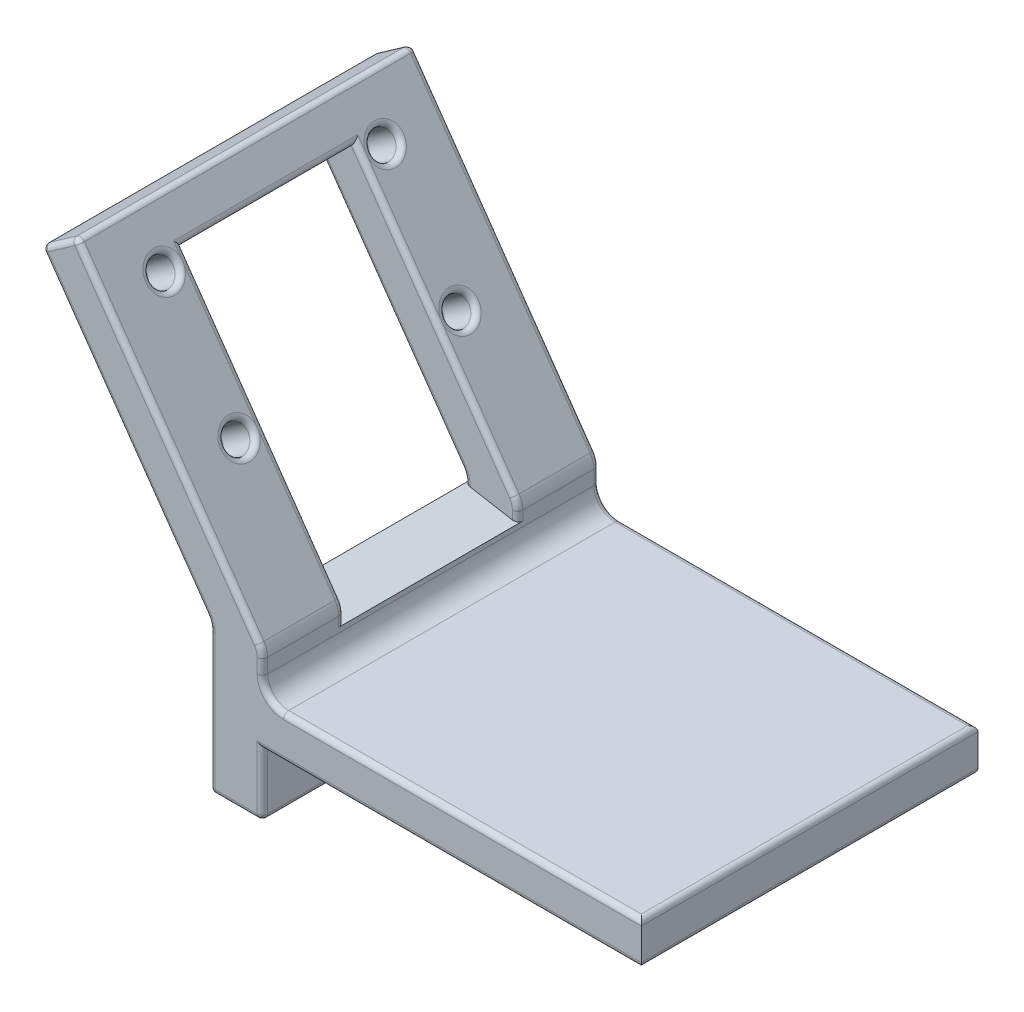
from build123d import *

# Parameters (mm, degrees)
BOSS_EXTRU_1_DEPTH      = 32
ESQUISSE2_R             = 1.25
ENL_V_MAT_EXTRU_1_DEPTH = 62.748876622
ESQUISSE3_R             = 1.25
ESQUISSE3_W             = 16.5
ESQUISSE3_H             = 24
ENL_V_MAT_EXTRU_2_DEPTH = 59.140175519
ESQUISSE4_R             = 2.15
ENL_V_MAT_EXTRU_3_DEPTH = 2
CHANFREIN1_SIZE         = 5
CONG_1_R                = 2
CONG_2_R                = 0.5


# Some blends are built 0.0001 mm under size
with BuildPart() as part:
    # Esquisse1 → Boss.-Extru.1 (new body)
    with BuildSketch(Plane.XY):
        Polygon((0, 0), (0, -6), (-5, -6), (-5, 8), (-21.060140218, 30.93625724), (-17.70508986, 33.285488792), (0, 8), (0, 4), (36, 4), (36, 0), align=None)
    extrude(amount=BOSS_EXTRU_1_DEPTH)

    # Esquisse2 → Enlèv. mat.-Extru.1 (cut, through all)
    with BuildSketch(Plane.ZY.offset(5)):
        with Locations(Location((8, -2.7, 0), (0, 0, 270))):
            Circle(ESQUISSE2_R)
        with Locations(Location((24, -2.7, 0), (0, 0, 270))):
            Circle(ESQUISSE2_R)
    extrude(amount=-ENL_V_MAT_EXTRU_1_DEPTH, mode=Mode.SUBTRACT)

    # Esquisse3 → Enlèv. mat.-Extru.2 (cut, through all)
    with BuildSketch(Plane(origin=(0.403720125, 0.282687875, 0), x_dir=(0, 0, 1), z_dir=(-0.819152044288991, -0.5735764363510472, 0))):
        with Locations(Location((5.5, 32.421098536, 0), (0, 0, 270))):
            Circle(ESQUISSE3_R)
        with Locations(Location((5.5, 20.021098536, 0), (0, 0, 270))):
            Circle(ESQUISSE3_R)
        with Locations(Location((26.5, 32.421098536, 0), (0, 0, 270))):
            Circle(ESQUISSE3_R)
        with Locations(Location((26.5, 20.021098536, 0), (0, 0, 270))):
            Circle(ESQUISSE3_R)
        with Locations((16, 21.421098536)):
            Rectangle(ESQUISSE3_W, ESQUISSE3_H)
    extrude(amount=-ENL_V_MAT_EXTRU_2_DEPTH, mode=Mode.SUBTRACT)

    # Esquisse4 → Enlèv. mat.-Extru.3 (cut)
    with BuildSketch(Plane.ZY.offset(5)):
        with Locations(Location((8, -2.7, 0), (0, 0, 270))):
            Circle(ESQUISSE4_R)
        with Locations(Location((24, -2.7, 0), (0, 0, 270))):
            Circle(ESQUISSE4_R)
    extrude(amount=-ENL_V_MAT_EXTRU_3_DEPTH, mode=Mode.SUBTRACT)

    # Chanfrein1
    # the kernel refuses this chamfer: 5 mm, written as the material it takes off along each edge
    with BuildSketch(Plane(origin=(-1.644949642, 10.349231552, 24.25), x_dir=(0.595882880335464, -0.8030713498333203, 0), z_dir=(0, 0, -1))) as chanfrein1_piece_1:
        Polygon((CHANFREIN1_SIZE * 0.999621916911, CHANFREIN1_SIZE * 0.0274958766106), (-CHANFREIN1_SIZE * 0.0274958766106, CHANFREIN1_SIZE * 0.999621916911), (0, 0), align=None)
    extrude(amount=16.5, mode=Mode.SUBTRACT)

    # Congé1
    cong_1_edges = [part.edges().sort_by_distance(p)[0] for p in [
        (0, 8, 3.875),
        (-5, 8, 28.125),
        (0, 8, 28.125),
        (0, 4, 16),
        (-5, 8, 3.875),
    ]]
    fillet(cong_1_edges, radius=CONG_1_R)

    # Congé2
    cong_2_edges = [part.edges().sort_by_distance(p)[0] for p in [
        (19, 4, 32),
        (0, 6.919254878, 24.25),
        (-13.210918065, 19.726406268, 0),
        (-19.382615039, 32.110873016, 0),
        (19, 4, 0),
        (18, 0, 0),
        (-5, 7.360072329, 24.25),
        (-5, 0.684701211, 0),
        (-5, 0.684701211, 32),
        (-12.063765192, 18.088102179, 24.25),
        (-7.886240013, 19.262717955, 24.25),
        (-9.033392885, 20.901022044, 0),
        (-9.033392885, 20.901022044, 32),
        (0, 6.684701211, 0),
        (-0.092566099, 7.970814021, 0),
        (0, 6.684701211, 32),
        (0, 6.919254878, 7.75),
        (-0.092566099, 7.970814021, 7.75),
        (-0.092566099, 7.970814021, 24.25),
        (-0.092566099, 7.970814021, 32),
        (-5.092566099, 7.970814021, 24.25),
        (-5.092566099, 7.970814021, 32),
        (-5.092566099, 7.970814021, 0),
        (-5.092566099, 7.970814021, 7.75),
        (0.585786438, 4.585786438, 0),
        (0.585786438, 4.585786438, 32),
        (0, -6, 16),
        (-5, -6, 16),
        (-21.060140218, 30.93625724, 16),
        (-17.70508986, 33.285488792, 16),
        (36, 4, 16),
        (36, 0, 16),
        (-19.382615039, 32.110873016, 32),
        (-13.210918065, 19.726406268, 32),
        (-2.5, -6, 32),
        (0, -3, 32),
        (0, -1.45, 8),
        (0, -1.45, 24),
        (18, 0, 32),
        (-15.554178223, 30.213668626, 26.5),
        (-18.909228582, 27.864437074, 26.5),
        (-8.441830412, 20.056183277, 26.5),
        (-11.796880771, 17.706951725, 26.5),
        (-15.554178223, 30.213668626, 5.5),
        (-18.909228582, 27.864437074, 5.5),
        (-8.441830412, 20.056183277, 5.5),
        (-11.796880771, 17.706951725, 5.5),
        (-7.886240013, 19.262717955, 7.75),
        (-15.410784114, 30.008880615, 16),
        (-12.063765192, 18.088102179, 7.75),
        (-18.765834472, 27.659649063, 16),
        (-5, -0.55, 8),
        (-3, -1.45, 8),
        (-5, -0.55, 24),
        (-3, -1.45, 24),
        (0, -3, 0),
        (-2.5, -6, 0),
        (-5, 7.360072329, 7.75),
    ]]
    fillet(cong_2_edges, radius=CONG_2_R - 0.0001)  # a hair under: the kernel refuses the full size


solid = part.part
